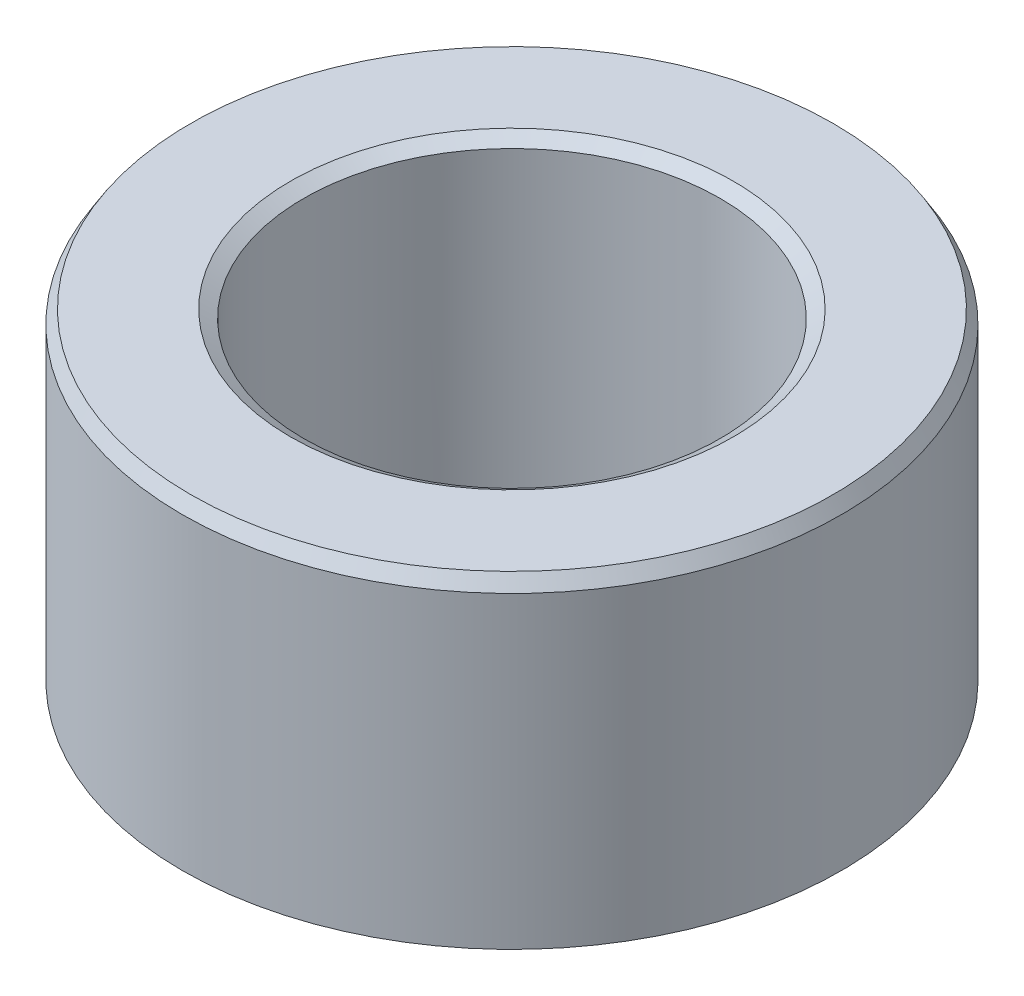
from build123d import *
from OCP.BRepFilletAPI import BRepFilletAPI_MakeChamfer

# Parameters (mm, degrees)
SKETCH1_R           = 45
BOSS_EXTRUDE1_DEPTH = 45.028984585
SKETCH2_R           = 28.423496985
CUT_EXTRUDE1_DEPTH  = 78.95902419
CHAMFER1_SIZE       = 1.820177314
CHAMFER1_SIZE2      = 1.118301384


with BuildPart() as part:
    # Sketch1 → Boss-Extrude1 (new body)
    with BuildSketch(Plane(origin=(0, 0, 0), x_dir=(1, 0, 0), z_dir=(0, 1, 0))):
        Circle(SKETCH1_R)
    extrude(amount=BOSS_EXTRUDE1_DEPTH)

    # Sketch2 → Cut-Extrude1 (cut, through all)
    with BuildSketch(Plane(origin=(0, 0, 0), x_dir=(1, 0, 0), z_dir=(0, 1, 0))):
        Circle(SKETCH2_R)
    extrude(amount=CUT_EXTRUDE1_DEPTH, mode=Mode.SUBTRACT)

    # Chamfer1: one chamfer whose edges measure the first distance from different faces: ONE call of the kernel's chamfer builder (chamfer() names one face for all edges)
    chamfer1_edges_1 = [part.edges().sort_by_distance(p)[0] for p in [
        (-28.423496985, 45.028984585, 0),
    ]]
    chamfer1_side_1 = [part.faces().sort_by_distance(p)[0] for p in [
        (-43.727207794, 45.028984585, 0),
    ]]
    chamfer1_edges_2 = [part.edges().sort_by_distance(p)[0] for p in [
        (-28.423496985, 0, 0),
    ]]
    chamfer1_side_2 = [part.faces().sort_by_distance(p)[0] for p in [
        (-28.423496985, 22.514492292, 0),
    ]]
    chamfer1_edges_3 = [part.edges().sort_by_distance(p)[0] for p in [
        (-45, 0, 0),
    ]]
    chamfer1_side_3 = [part.faces().sort_by_distance(p)[0] for p in [
        (-43.727207794, 0, 0),
    ]]
    chamfer1_edges_4 = [part.edges().sort_by_distance(p)[0] for p in [
        (-45, 45.028984585, 0),
    ]]
    chamfer1_side_4 = [part.faces().sort_by_distance(p)[0] for p in [
        (-45, 22.514492292, 0),
    ]]
    chamfer1 = BRepFilletAPI_MakeChamfer(part.part.solid().wrapped)
    for e in chamfer1_edges_1:
        chamfer1.Add(CHAMFER1_SIZE, CHAMFER1_SIZE2, e.wrapped, chamfer1_side_1[0].wrapped)  # the first distance lies on this face
    for e in chamfer1_edges_2:
        chamfer1.Add(CHAMFER1_SIZE, CHAMFER1_SIZE2, e.wrapped, chamfer1_side_2[0].wrapped)  # the first distance lies on this face
    for e in chamfer1_edges_3:
        chamfer1.Add(CHAMFER1_SIZE, CHAMFER1_SIZE2, e.wrapped, chamfer1_side_3[0].wrapped)  # the first distance lies on this face
    for e in chamfer1_edges_4:
        chamfer1.Add(CHAMFER1_SIZE, CHAMFER1_SIZE2, e.wrapped, chamfer1_side_4[0].wrapped)  # the first distance lies on this face
    add(Compound.cast(chamfer1.Shape()), mode=Mode.REPLACE)


solid = part.part
